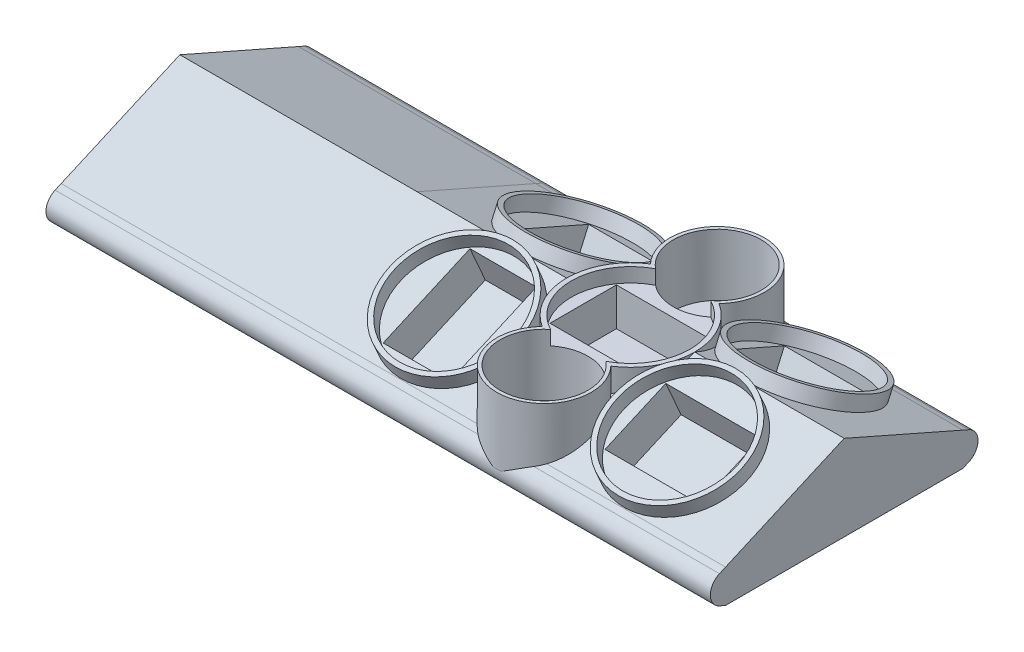
from build123d import *

# Parameters (mm, degrees)
SKETCH1_W            = 50
SKETCH1_H            = 7
BOSS_EXTRUDE1_DEPTH  = 90
SKETCH2_R            = 13.5
BOSS_EXTRUDE2_DEPTH  = 8
BOSS_EXTRUDE3_DEPTH  = 3
BOSS_EXTRUDE4_DEPTH  = 3
SKETCH5_R            = 12.5
CUT_EXTRUDE1_DEPTH   = 3
SKETCH6_W            = 20
SKETCH6_H            = 14
SKETCH6_W_2          = 14
SKETCH6_H_2          = 20
CUT_EXTRUDE3_DEPTH   = 8
SKETCH7_W            = 20
SKETCH7_H            = 14
SKETCH7_W_2          = 14
SKETCH7_H_2          = 20
CUT_EXTRUDE4_DEPTH   = 8
SKETCH8_W            = 20
SKETCH8_H            = 14
CUT_EXTRUDE5_DEPTH   = 8
BOSS_EXTRUDE6_START  = -90
BOSS_EXTRUDE6_DEPTH  = 90
SKETCH12_R           = 9.956392443
SKETCH12_R_2         = 9.25
SKETCH12_R_3         = 9.953463084
BOSS_EXTRUDE7_DEPTH  = 14
SKETCH13_R           = 12.5
CUT_EXTRUDE6_DEPTH   = 3
SKETCH14_R           = 9.25
BOSS_EXTRUDE8_DEPTH  = 13
SKETCH15_R           = 9.25
CUT_EXTRUDE7_DEPTH   = 13
BOSS_EXTRUDE11_DEPTH = 50


with BuildPart() as part:
    # Sketch1 → Boss-Extrude1 (new body)
    with BuildSketch(Plane(origin=(0, 0, 0), x_dir=(0, 0, -1), z_dir=(1, 0, 0))):
        Polygon((-91.782967909, 5.403450034), (-91.782967909, -5.596549966), (-66.782967909, -5.596549966), align=None)
        with Locations((-91.782967909, -9.096549966)):
            Rectangle(SKETCH1_W, SKETCH1_H)
        Polygon((-116.782967909, -5.596549966), (-91.782967909, -5.596549966), (-91.782967909, 5.403450034), align=None)
    extrude(amount=-BOSS_EXTRUDE1_DEPTH)

    # Sketch2 → Boss-Extrude2 (add)
    with BuildSketch(Plane(origin=(0, 5.403450034, 0), x_dir=(-1, 0, 0), z_dir=(0, -1, 0))):
        with Locations((45, -91.782967909)):
            Circle(SKETCH2_R)
    extrude(amount=BOSS_EXTRUDE2_DEPTH)

    # Sketch3 → Boss-Extrude3 (add)
    with BuildSketch(Plane(origin=(0, 38.361223118, 16.878938172), x_dir=(1, 0, 0), z_dir=(0, 0.9153150324227656, 0.402738614266017))):
        with BuildLine():
            Line((-58.5, -87.990652552), (-58.5, -86.421473978))
            ThreePointArc((-58.5, -86.421473978), (-82, -95.490652552), (-58.5, -104.559831125))
            Line((-58.5, -104.559831125), (-58.5, -102.990652552))
            ThreePointArc((-58.5, -102.990652552), (-81, -95.490652552), (-58.5, -87.990652552))
        make_face()
        with BuildLine():
            ThreePointArc((-57.25492495, -88.020827445), (-57.847404713, -87.19775115), (-58.5, -86.421473978))
            Line((-58.5, -86.421473978), (-58.5, -87.990652552))
            ThreePointArc((-58.5, -87.990652552), (-56.641458774, -91.537805477), (-56, -95.490652552))
            ThreePointArc((-56, -95.490652552), (-56.641458774, -99.443499627), (-58.5, -102.990652552))
            Line((-58.5, -102.990652552), (-58.5, -104.559831125))
            ThreePointArc((-58.5, -104.559831125), (-55.905358282, -100.351208076), (-55, -95.490652552))
            ThreePointArc((-55, -95.490652552), (-55.254365648, -92.882363724), (-56.007877127, -90.37236513))
            add(Edge.make_bspline(
                [(-57.25492495, -88.020827445), (-56.730976667, -89.259625667), (-56.007877127, -90.37236513)],
                knots=[2.018456538, 2.018456538, 2.018456538, 2.19652694, 2.19652694, 2.19652694], degree=2, weights=[0.880634053, 0.866355929, 0.859605864]))
        make_face()
        with BuildLine():
            ThreePointArc((-56.007877127, -90.37236513), (-56.573304159, -89.165786836), (-57.25492495, -88.020827445))
            add(Edge.make_bspline(
                [(-57.25492495, -88.020827445), (-56.730976667, -89.259625667), (-56.007877127, -90.37236513)],
                knots=[2.018456538, 2.018456538, 2.018456538, 2.19652694, 2.19652694, 2.19652694], degree=2, weights=[0.880634053, 0.866355929, 0.859605864]))
        make_face()
        with BuildLine():
            ThreePointArc((-8, -95.490652552), (-16.639444476, -82.896010834), (-31.5, -86.421473978))
            Line((-31.5, -86.421473978), (-31.5, -87.990652552))
            ThreePointArc((-31.5, -87.990652552), (-17.547152925, -83.632111326), (-9, -95.490652552))
            ThreePointArc((-9, -95.490652552), (-17.547152925, -107.349193777), (-31.5, -102.990652552))
            Line((-31.5, -102.990652552), (-31.5, -104.559831125))
            ThreePointArc((-31.5, -104.559831125), (-16.639444476, -108.08529427), (-8, -95.490652552))
        make_face()
        with BuildLine():
            Line((-31.5, -87.990652552), (-31.5, -86.421473978))
            ThreePointArc((-31.5, -86.421473978), (-32.152595287, -87.19775115), (-32.74507505, -88.020827445))
            add(Edge.make_bspline(
                [(-33.992122873, -90.37236513), (-33.269023333, -89.259625667), (-32.74507505, -88.020827445)],
                knots=[4.086658367, 4.086658367, 4.086658367, 4.264728769, 4.264728769, 4.264728769], degree=2, weights=[0.859605864, 0.866355929, 0.880634053]))
            ThreePointArc((-33.992122873, -90.37236513), (-34.796426049, -97.826258325), (-31.5, -104.559831125))
            Line((-31.5, -104.559831125), (-31.5, -102.990652552))
            ThreePointArc((-31.5, -102.990652552), (-34, -95.490652552), (-31.5, -87.990652552))
        make_face()
        with BuildLine():
            add(Edge.make_bspline(
                [(-33.992122873, -90.37236513), (-33.269023333, -89.259625667), (-32.74507505, -88.020827445)],
                knots=[4.086658367, 4.086658367, 4.086658367, 4.264728769, 4.264728769, 4.264728769], degree=2, weights=[0.859605864, 0.866355929, 0.880634053]))
            ThreePointArc((-32.74507505, -88.020827445), (-33.426695841, -89.165786836), (-33.992122873, -90.37236513))
        make_face()
    extrude(amount=BOSS_EXTRUDE3_DEPTH)

    # Sketch4 → Boss-Extrude4 (add)
    with BuildSketch(Plane(origin=(0, -29.307184857, 12.895161337), x_dir=(1, 0, 0), z_dir=(0, 0.9153150324227658, -0.4027386142660168))):
        with BuildLine():
            ThreePointArc((-58.5, -63.460829369), (-82, -72.530007942), (-58.5, -81.599186516))
            Line((-58.5, -81.599186516), (-58.5, -80.030007942))
            ThreePointArc((-58.5, -80.030007942), (-81, -72.530007942), (-58.5, -65.030007942))
            Line((-58.5, -65.030007942), (-58.5, -63.460829369))
        make_face()
        with BuildLine():
            add(Edge.make_bspline(
                [(-56.007877127, -77.648295364), (-56.730976667, -78.761034827), (-57.25492495, -79.999833049)],
                knots=[4.086658367, 4.086658367, 4.086658367, 4.264728769, 4.264728769, 4.264728769], degree=2, weights=[0.859605864, 0.866355929, 0.880634053]))
            ThreePointArc((-56.007877127, -77.648295364), (-55.254365648, -75.13829677), (-55, -72.530007942))
            ThreePointArc((-55, -72.530007942), (-55.905358282, -67.669452418), (-58.5, -63.460829369))
            Line((-58.5, -63.460829369), (-58.5, -65.030007942))
            ThreePointArc((-58.5, -65.030007942), (-56.641458774, -68.577160867), (-56, -72.530007942))
            ThreePointArc((-56, -72.530007942), (-56.641458774, -76.482855017), (-58.5, -80.030007942))
            Line((-58.5, -80.030007942), (-58.5, -81.599186516))
            ThreePointArc((-58.5, -81.599186516), (-57.847404713, -80.822909344), (-57.25492495, -79.999833049))
        make_face()
        with BuildLine():
            ThreePointArc((-57.25492495, -79.999833049), (-56.573304159, -78.854873658), (-56.007877127, -77.648295364))
            add(Edge.make_bspline(
                [(-56.007877127, -77.648295364), (-56.730976667, -78.761034827), (-57.25492495, -79.999833049)],
                knots=[4.086658367, 4.086658367, 4.086658367, 4.264728769, 4.264728769, 4.264728769], degree=2, weights=[0.859605864, 0.866355929, 0.880634053]))
        make_face()
        with BuildLine():
            Line((-31.5, -80.030007942), (-31.5, -81.599186516))
            ThreePointArc((-31.5, -81.599186516), (-16.639444476, -85.12464966), (-8, -72.530007942))
            ThreePointArc((-8, -72.530007942), (-16.639444476, -59.935366224), (-31.5, -63.460829369))
            Line((-31.5, -63.460829369), (-31.5, -65.030007942))
            ThreePointArc((-31.5, -65.030007942), (-17.547152925, -60.671466717), (-9, -72.530007942))
            ThreePointArc((-9, -72.530007942), (-17.547152925, -84.388549168), (-31.5, -80.030007942))
        make_face()
        with BuildLine():
            ThreePointArc((-32.74507505, -79.999833049), (-32.152595287, -80.822909344), (-31.5, -81.599186516))
            Line((-31.5, -81.599186516), (-31.5, -80.030007942))
            ThreePointArc((-31.5, -80.030007942), (-34, -72.530007942), (-31.5, -65.030007942))
            Line((-31.5, -65.030007942), (-31.5, -63.460829369))
            ThreePointArc((-31.5, -63.460829369), (-34.796426049, -70.194402169), (-33.992122873, -77.648295364))
            add(Edge.make_bspline(
                [(-32.74507505, -79.999833049), (-33.269023333, -78.761034827), (-33.992122873, -77.648295364)],
                knots=[2.018456538, 2.018456538, 2.018456538, 2.19652694, 2.19652694, 2.19652694], degree=2, weights=[0.880634053, 0.866355929, 0.859605864]))
        make_face()
        with BuildLine():
            ThreePointArc((-33.992122873, -77.648295364), (-33.426695841, -78.854873658), (-32.74507505, -79.999833049))
            add(Edge.make_bspline(
                [(-32.74507505, -79.999833049), (-33.269023333, -78.761034827), (-33.992122873, -77.648295364)],
                knots=[2.018456538, 2.018456538, 2.018456538, 2.19652694, 2.19652694, 2.19652694], degree=2, weights=[0.880634053, 0.866355929, 0.859605864]))
        make_face()
    extrude(amount=BOSS_EXTRUDE4_DEPTH)

    # Sketch5 → Cut-Extrude1 (cut)
    with BuildSketch(Plane(origin=(0, 5.403450034, 0), x_dir=(1, 0, 0), z_dir=(0, 1, 0))):
        with Locations(Location((-45, -91.782967909, 0), (0, 0, 270))):
            Circle(SKETCH5_R)
    extrude(amount=-CUT_EXTRUDE1_DEPTH, mode=Mode.SUBTRACT)

    # Sketch6 → Cut-Extrude3 (cut)
    with BuildSketch(Plane(origin=(0, 38.361223118, 16.878938172), x_dir=(1, 0, 0), z_dir=(0, 0.9153150324227656, 0.402738614266017))):
        with Locations((-21.5, -95.490652552)):
            Rectangle(SKETCH6_W, SKETCH6_H)
        with Locations((-68.5, -95.490652552)):
            Rectangle(SKETCH6_W_2, SKETCH6_H_2)
    extrude(amount=-CUT_EXTRUDE3_DEPTH, mode=Mode.SUBTRACT)

    # Sketch7 → Cut-Extrude4 (cut)
    with BuildSketch(Plane(origin=(0, -29.307184857, 12.895161337), x_dir=(1, 0, 0), z_dir=(0, 0.9153150324227658, -0.4027386142660168))):
        with Locations((-21.5, -72.530007942)):
            Rectangle(SKETCH7_W, SKETCH7_H)
        with Locations((-68.5, -72.530007942)):
            Rectangle(SKETCH7_W_2, SKETCH7_H_2)
    extrude(amount=-CUT_EXTRUDE4_DEPTH, mode=Mode.SUBTRACT)

    # Sketch8 → Cut-Extrude5 (cut)
    with BuildSketch(Plane(origin=(0, 2.403450034, 0), x_dir=(1, 0, 0), z_dir=(0, 1, 0))):
        with Locations((-45, -91.782967909)):
            Rectangle(SKETCH8_W, SKETCH8_H)
    extrude(amount=-CUT_EXTRUDE5_DEPTH, mode=Mode.SUBTRACT)

    # Boss-Extrude6: read off the stored shape, not the designer's step
    # Boss-Extrude6 outline → Boss-Extrude6 (add)
    with BuildSketch(Plane(origin=(0, 0, 0), x_dir=(0, 0, -1), z_dir=(1, 0, 0)).offset(BOSS_EXTRUDE6_START)):
        with BuildLine():
            Line((-116.782967909, -5.596549966), (-118.067182683, -6.158566829))
            ThreePointArc((-118.067182683, -6.158566829), (-119.989357883, -9.092571086), (-118.074470332, -12.031336839))
            Line((-118.074470332, -12.031336839), (-116.782967909, -12.596549966))
            Line((-116.782967909, -12.596549966), (-116.782967909, -5.596549966))
        make_face()
        with BuildLine():
            Line((-65.492795381, -6.164378317), (-66.782994627, -5.596683168))
            Line((-66.782994627, -5.596683168), (-66.782967909, -12.596549966))
            Line((-66.782967909, -12.596549966), (-65.498754212, -12.031336314))
            ThreePointArc((-65.498754212, -12.031336314), (-63.579506477, -9.099803591), (-65.492795381, -6.164378317))
        make_face()
    extrude(amount=BOSS_EXTRUDE6_DEPTH)

    # Sketch12 → Boss-Extrude7 (add)
    # profile 1 of 2: a face of its own
    with BuildSketch(Plane(origin=(0, 5.403450034, 0), x_dir=(-1, 0, 0), z_dir=(0, -1, 0))):
        with Locations((45, -110.032967909)):
            Circle(SKETCH12_R)
        with Locations((45, -110.032967909)):
            Circle(SKETCH12_R_2, mode=Mode.SUBTRACT)
    # profile 2 of 2: a face of its own
    with BuildSketch(Plane(origin=(0, 5.403450034, 0), x_dir=(-1, 0, 0), z_dir=(0, -1, 0))):
        with Locations((45, -73.532967909)):
            Circle(SKETCH12_R_3)
        with Locations((45, -73.532967909)):
            Circle(SKETCH12_R_2, mode=Mode.SUBTRACT)
    extrude(amount=BOSS_EXTRUDE7_DEPTH)

    # Sketch13 → Cut-Extrude6 (cut)
    with BuildSketch(Plane(origin=(0, 5.403450034, 0), x_dir=(1, 0, 0), z_dir=(0, 1, 0))):
        with Locations(Location((-45, -91.782967909, 0), (0, 0, 270))):
            Circle(SKETCH13_R)
    extrude(amount=-CUT_EXTRUDE6_DEPTH, mode=Mode.SUBTRACT)


with BuildPart() as boss_extrude8_tool:
    # Sketch14 → Boss-Extrude8 (new body)
    with BuildSketch(Plane(origin=(0, 5.403450034, 0), x_dir=(1, 0, 0), z_dir=(0, 1, 0))):
        with Locations((-45, -110.032967909)):
            Circle(SKETCH14_R)
        with Locations((-45, -73.532967909)):
            Circle(SKETCH14_R)
    extrude(amount=-BOSS_EXTRUDE8_DEPTH)


with BuildPart() as part_1:
    add(part.part)


with BuildPart() as part_2:
    # Boss-Extrude8: joined with boss_extrude8_tool
    add(part_1.part.fuse(boss_extrude8_tool.part, tol=0.00001))

    # Sketch15 → Cut-Extrude7 (cut)
    with BuildSketch(Plane(origin=(0, 5.403450034, 0), x_dir=(1, 0, 0), z_dir=(0, 1, 0))):
        with Locations(Location((-45, -110.032967909, 0), (0, 0, 270))):
            Circle(SKETCH15_R)
        with Locations(Location((-45, -73.532967909, 0), (0, 0, 270))):
            Circle(SKETCH15_R)
    extrude(amount=-CUT_EXTRUDE7_DEPTH, mode=Mode.SUBTRACT)

    # Boss-Extrude11: read off the stored shape, not the designer's step
    # Boss-Extrude11 outline → Boss-Extrude11 (add)
    with BuildSketch(Plane.ZY.offset(90)):
        with BuildLine():
            ThreePointArc((65.492795381, -6.164378317), (63.579506477, -9.099803591), (65.498754212, -12.031336314))
            Line((65.498754212, -12.031336314), (66.782967909, -12.596549966))
            Line((66.782967909, -12.596549966), (116.782967909, -12.596549966))
            Line((116.782967909, -12.596549966), (118.074470332, -12.031336839))
            ThreePointArc((118.074470332, -12.031336839), (119.989357883, -9.092571086), (118.067182683, -6.158566829))
            Line((118.067182683, -6.158566829), (116.782967909, -5.596549966))
            Line((116.782967909, -5.596549966), (91.782967909, 5.403450034))
            Line((91.782967909, 5.403450034), (66.782967909, -5.596622445))
            Line((66.782967909, -5.596622445), (65.492795381, -6.164378317))
        make_face()
    extrude(amount=BOSS_EXTRUDE11_DEPTH)


solid = part_2.part
